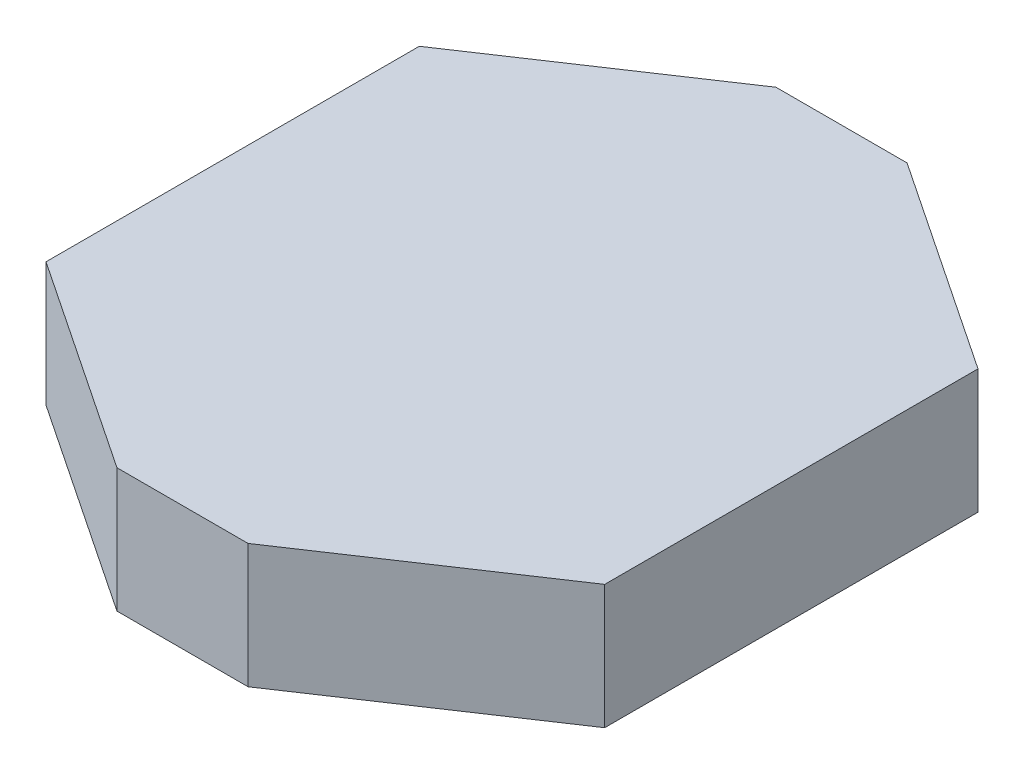
from build123d import *

# Parameters (mm, degrees)
BOSS_EXTRUDE1_DEPTH   = 10
BODY_MOVE_COPY1_DEPTH = 10


# Read off the part's stored shape, not the designer's step: Body-Move/Copy1
with BuildPart() as part:
    # Sketch1 → Boss-Extrude1 (new body)
    with BuildSketch(Plane(origin=(0, 0, 0), x_dir=(1, 0, 0), z_dir=(0, 1, 0))):
        Polygon((5.279106073, 26.539858442), (22.499405578, 15.033622173), (22.499405578, -15.033622173), (5.279106073, -26.539858442), (-5.279106073, -26.539858442), (-22.499405578, -15.033622173), (-22.499405578, 15.033622173), (-5.279106073, 26.539858442), align=None)
    extrude(amount=BOSS_EXTRUDE1_DEPTH)


with BuildPart() as body_2:
    # Body-Move/Copy1 outline → Body-Move/Copy1 (new body)
    with BuildSketch(Plane(origin=(0, 0, 0), x_dir=(1, 0, 0), z_dir=(0, 1, 0))):
        Polygon((5.279106073, 26.539858442), (-5.279106073, 26.539858442), (-22.499405578, 15.033622173), (-22.499405578, -15.033622173), (-5.279106073, -26.539858442), (5.279106073, -26.539858442), (22.499405578, -15.033622173), (22.499405578, 15.033622173), align=None)
    extrude(amount=BODY_MOVE_COPY1_DEPTH)


solid = Compound([part.part, body_2.part])
